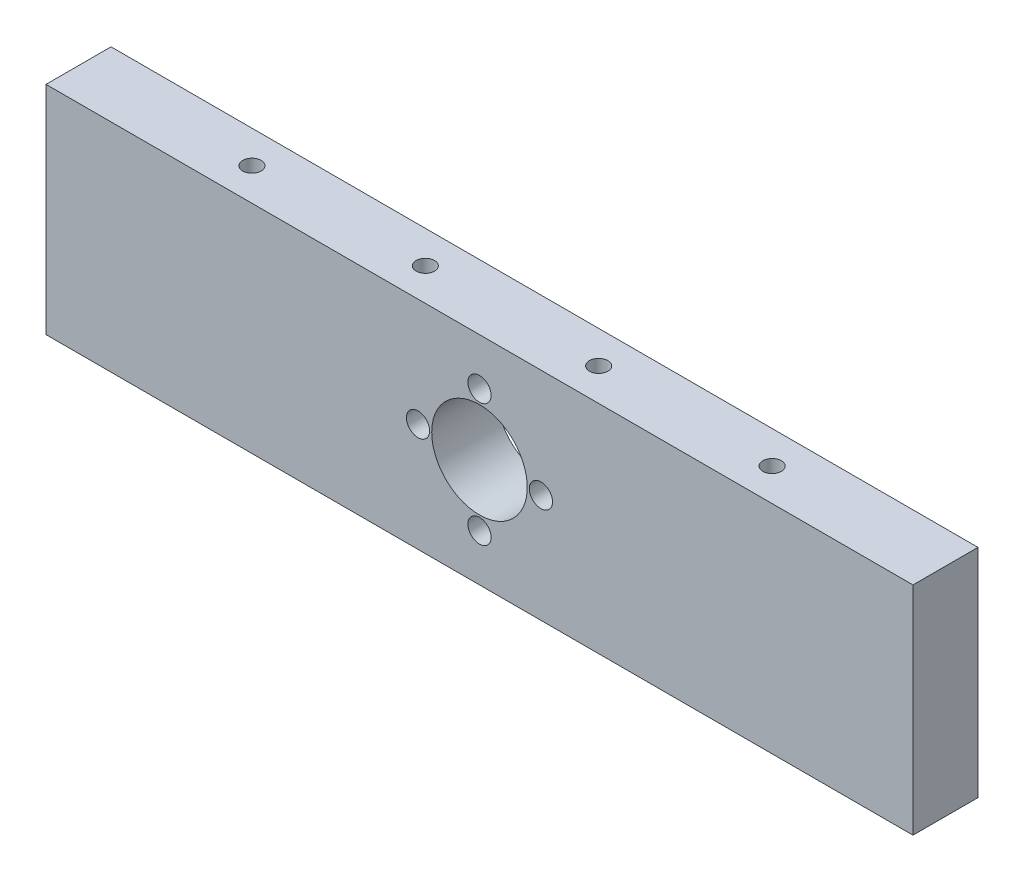
from build123d import *

# Parameters (mm, degrees)
SKETCH1_W           = 127
SKETCH1_H           = 31.75
SKETCH1_R           = 1.7
SKETCH1_R_2         = 7
BOSS_EXTRUDE1_DEPTH = 9.525
LPATTERN1_COUNT     = 4
LPATTERN1_PITCH     = 25.4


with BuildPart() as part:
    # Sketch1 → Boss-Extrude1 (new body)
    with BuildSketch(Plane.XY):
        Rectangle(SKETCH1_W, SKETCH1_H)
        with Locations((0, -9)):
            Circle(SKETCH1_R, mode=Mode.SUBTRACT)
        with Locations((-9, 0)):
            Circle(SKETCH1_R, mode=Mode.SUBTRACT)
        with Locations((0, 9)):
            Circle(SKETCH1_R, mode=Mode.SUBTRACT)
        with Locations((9, 0)):
            Circle(SKETCH1_R, mode=Mode.SUBTRACT)
        Circle(SKETCH1_R_2, mode=Mode.SUBTRACT)
    extrude(amount=BOSS_EXTRUDE1_DEPTH)

    # Sketch12 → Tap Drill for #6-32 Tap1 (revolve, cut)
    with BuildSketch(Plane(origin=(38.1, -15.875, 4.7625), x_dir=(0, 0, -1), z_dir=(1, 0, 0))):
        Polygon((0, 0), (0, 13.51269403), (1.35255, 12.7), (1.35255, 0), align=None)
    tap_drill_for_6_32_tap1 = revolve(axis=Axis((38.1, -22.225, 4.7625), (0, 1, 0)), mode=Mode.SUBTRACT)

    # LPattern1: Tap Drill for #6-32 Tap1 ×4
    with Locations(*[(-i * LPATTERN1_PITCH, 0, 0) for i in range(1, LPATTERN1_COUNT)]):
        add(tap_drill_for_6_32_tap1, mode=Mode.SUBTRACT)

    # Mirror8: Tap Drill for #6-32 Tap1 across plane
    add(tap_drill_for_6_32_tap1.mirror(Plane.ZX), mode=Mode.SUBTRACT)

    # Mirror8 copy 1 sketch → Mirror8 copy 1 (revolve, cut)
    with BuildSketch(Plane(origin=(12.7, 15.875, 4.7625), x_dir=(0, 0, -1), z_dir=(1, 0, 0))):
        Polygon((0, 0), (0, -13.51269403), (1.35255, -12.7), (1.35255, 0), align=None)
    revolve(axis=Axis((12.7, 22.225, 4.7625), (0, 1, 0)), mode=Mode.SUBTRACT)

    # Mirror8 copy 2 sketch → Mirror8 copy 2 (revolve, cut)
    with BuildSketch(Plane(origin=(-12.7, 15.875, 4.7625), x_dir=(0, 0, -1), z_dir=(1, 0, 0))):
        Polygon((0, 0), (0, -13.51269403), (1.35255, -12.7), (1.35255, 0), align=None)
    revolve(axis=Axis((-12.7, 22.225, 4.7625), (0, 1, 0)), mode=Mode.SUBTRACT)

    # Mirror8 copy 3 sketch → Mirror8 copy 3 (revolve, cut)
    with BuildSketch(Plane(origin=(-38.1, 15.875, 4.7625), x_dir=(0, 0, -1), z_dir=(1, 0, 0))):
        Polygon((0, 0), (0, -13.51269403), (1.35255, -12.7), (1.35255, 0), align=None)
    revolve(axis=Axis((-38.1, 22.225, 4.7625), (0, 1, 0)), mode=Mode.SUBTRACT)


solid = part.part
